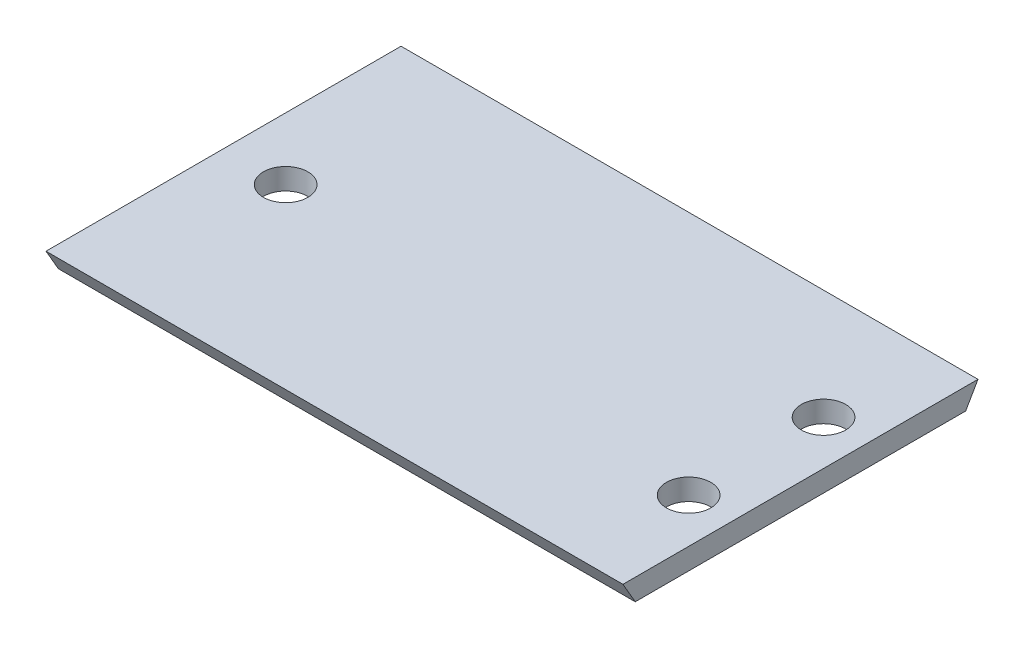
from build123d import *

# Parameters (mm, degrees)
SKETCH1_W           = 32.5
SKETCH1_H           = 20
SKETCH1_R           = 1.25
BOSS_EXTRUDE1_DEPTH = 1.2
CHAMFER1_SIZE       = 1.2
CHAMFER1_SIZE_2     = 0.692820323
CHAMFER2_SIZE       = 1.2
CHAMFER2_SIZE_2     = 0.692820323


with BuildPart() as part:
    # Sketch1 → Boss-Extrude1 (new body)
    with BuildSketch(Plane(origin=(0, 0, 0), x_dir=(1, 0, 0), z_dir=(0, 1, 0))):
        with Locations((16.25, 10)):
            Rectangle(SKETCH1_W, SKETCH1_H)
        with Locations(Location((30, 6.2, 0), (0, 0, 270))):
            Circle(SKETCH1_R, mode=Mode.SUBTRACT)
        with Locations(Location((30, 13.8, 0), (0, 0, 270))):
            Circle(SKETCH1_R, mode=Mode.SUBTRACT)
        with Locations(Location((3.5, 10, 0), (0, 0, 270))):
            Circle(SKETCH1_R, mode=Mode.SUBTRACT)
    extrude(amount=-BOSS_EXTRUDE1_DEPTH)

    # Chamfer1
    # the kernel refuses this chamfer: 1.2, 0.692820323 mm, written as the material it takes off along each edge
    with BuildSketch(Plane(origin=(35.604502906, -1.2, -20), x_dir=(0, 0.9998132206222078, -0.019326765612701437), z_dir=(-1, 0, 0))) as chamfer1_piece_1:
        Polygon((CHAMFER1_SIZE * 0.999813220622, -CHAMFER1_SIZE * 0.0193267656127), (-CHAMFER1_SIZE_2 * 0.0193267656135, -CHAMFER1_SIZE_2 * 0.999813220662), (0, 0), align=None)
    extrude(amount=38.709005811, mode=Mode.SUBTRACT)

    # Chamfer2
    # the kernel refuses this chamfer: 1.2, 0.692820323 mm, written as the material it takes off along each edge
    with BuildSketch(Plane(origin=(-3.104502906, -1.2, 0), x_dir=(0, 0.999813220622208, 0.01932676561270074), z_dir=(1, 0, 0))) as chamfer2_piece_1:
        Polygon((CHAMFER2_SIZE * 0.999813220622, -CHAMFER2_SIZE * 0.0193267656127), (-CHAMFER2_SIZE_2 * 0.0193267656135, -CHAMFER2_SIZE_2 * 0.999813220662), (0, 0), align=None)
    extrude(amount=38.709005811, mode=Mode.SUBTRACT)


solid = part.part
